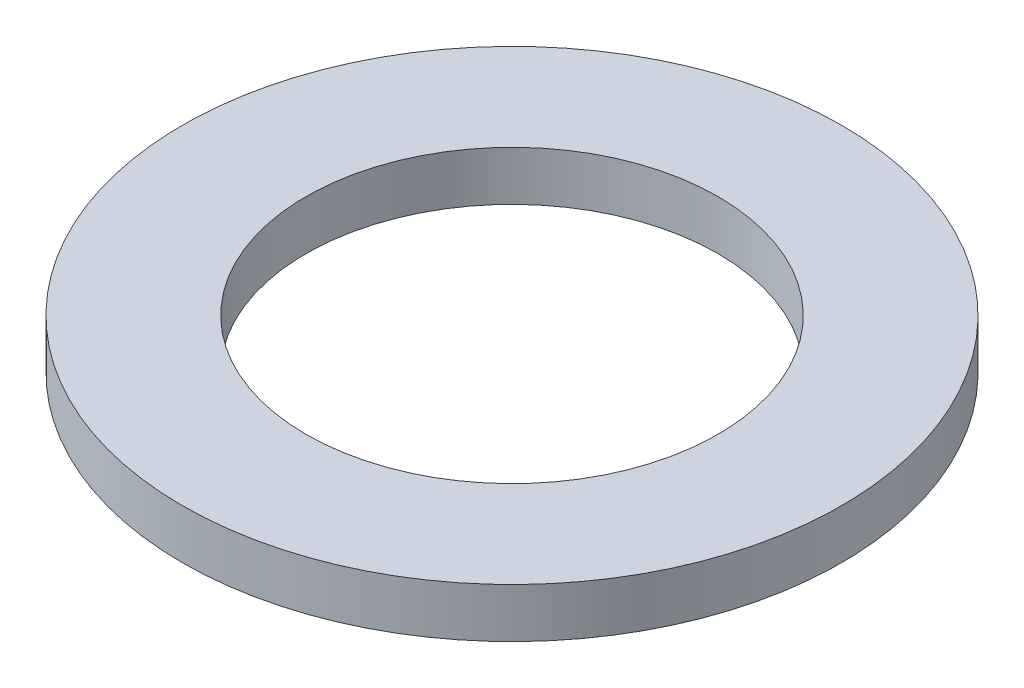
from build123d import *

# Parameters (mm, degrees)
SKETCH1_R           = 60
BOSS_EXTRUDE1_DEPTH = 9
SKETCH2_R           = 37.5
CUT_EXTRUDE1_DEPTH  = 86.32877592


with BuildPart() as part:
    # Sketch1 → Boss-Extrude1 (new body)
    with BuildSketch(Plane(origin=(0, 0, 0), x_dir=(1, 0, 0), z_dir=(0, 1, 0))):
        Circle(SKETCH1_R)
    extrude(amount=BOSS_EXTRUDE1_DEPTH)

    # Sketch2 → Cut-Extrude1 (cut, through all)
    with BuildSketch(Plane(origin=(0, 0, 0), x_dir=(1, 0, 0), z_dir=(0, 1, 0))):
        Circle(SKETCH2_R)
    extrude(amount=CUT_EXTRUDE1_DEPTH, mode=Mode.SUBTRACT)


solid = part.part
